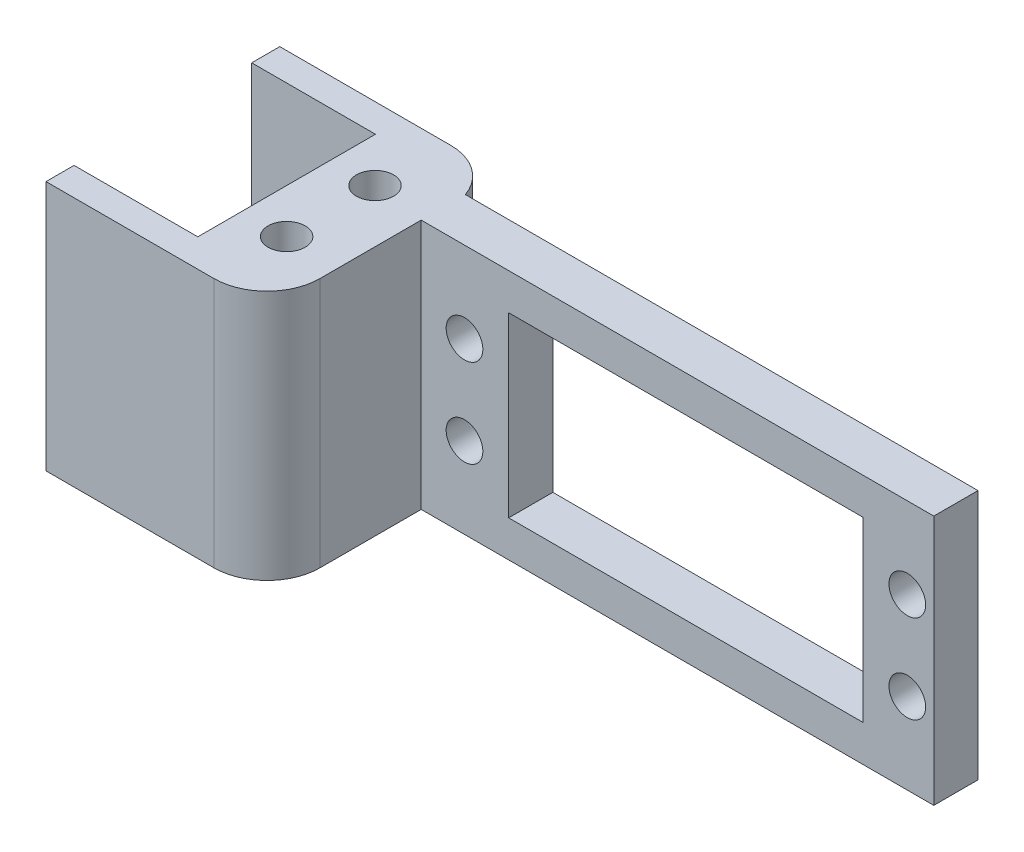
from build123d import *

# Parameters (mm, degrees)
SKETCH1_R               = 2.1
BOSS_EXTRUDE1_DEPTH     = 28.35
SKETCH2_W               = 5
SKETCH2_H               = 28.35
BOSS_EXTRUDE2_DEPTH     = 58
CUT_EXTRUDE1_DEPTH      = 91.535766413
CUT_EXTRUDE1_DEPTH_BACK = 91.535766413
SKETCH3_W               = 40.1
SKETCH3_H               = 20.1
CUT_EXTRUDE2_DEPTH      = 91.535766413
CUT_EXTRUDE2_DEPTH_BACK = 91.535766413
SKETCH4_R               = 2.075
FILLET1_R               = 6


with BuildPart() as part:
    # Sketch1 → Boss-Extrude1 (new body)
    with BuildSketch(Plane(origin=(0, 0, 0), x_dir=(1, 0, 0), z_dir=(0, 1, 0))):
        Polygon((0, 0), (14, 0), (14, -20.1), (0, -20.1), (0, -23.275), (25, -23.275), (25, 3.175), (0, 3.175), align=None)
        with Locations(Location((19, -5.05, 0), (0, 0, 90))):
            Circle(SKETCH1_R, mode=Mode.SUBTRACT)
        with Locations(Location((19, -15.05, 0), (0, 0, 90))):
            Circle(SKETCH1_R, mode=Mode.SUBTRACT)
    extrude(amount=BOSS_EXTRUDE1_DEPTH)

    # Sketch2 → Boss-Extrude2 (add)
    with BuildSketch(Plane(origin=(25, 0, 0), x_dir=(0, 0, -1), z_dir=(1, 0, 0))):
        with Locations((-3.325, 14.175)):
            Rectangle(SKETCH2_W, SKETCH2_H)
    extrude(amount=BOSS_EXTRUDE2_DEPTH)

    # Sketch3 → Cut-Extrude1 (cut, two sides: drawn at the far end of the back side and taken through both)
    with BuildSketch(Plane(origin=(0, 0, 0.825), x_dir=(-1, 0, 0), z_dir=(0, 0, -1)).offset(-CUT_EXTRUDE1_DEPTH_BACK)):
        with Locations((-54.95, 14.175)):
            Rectangle(SKETCH3_W, SKETCH3_H)
    extrude(amount=CUT_EXTRUDE1_DEPTH + CUT_EXTRUDE1_DEPTH_BACK, mode=Mode.SUBTRACT)

    # Sketch4 → Cut-Extrude2 (cut, two sides: drawn at the far end of the back side and taken through both)
    with BuildSketch(Plane(origin=(0, 0, 0.825), x_dir=(-1, 0, 0), z_dir=(0, 0, -1)).offset(-CUT_EXTRUDE2_DEPTH_BACK)):
        with Locations(Location((-29.9, 19.175, 0), (0, 0, 90))):
            Circle(SKETCH4_R)
        with Locations(Location((-29.9, 9.175, 0), (0, 0, 90))):
            Circle(SKETCH4_R)
        with Locations(Location((-80, 19.175, 0), (0, 0, 90))):
            Circle(SKETCH4_R)
        with Locations(Location((-80, 9.175, 0), (0, 0, 90))):
            Circle(SKETCH4_R)
    extrude(amount=CUT_EXTRUDE2_DEPTH + CUT_EXTRUDE2_DEPTH_BACK, mode=Mode.SUBTRACT)

    # Fillet1
    # the kernel refuses this fillet: 6 mm, written as the material it takes off along each edge
    with BuildSketch(Plane(origin=(25, -14.142135624, -3.175), x_dir=(-1, 0, 0), z_dir=(0, 1, 0))) as fillet1_piece_1:
        with BuildLine():
            CenterArc((5.656854249, 6), FILLET1_R, 199.471220634, 70.528779366)
            Line((0, 4), (-0.113137085, 3.96))
            ThreePointArc((-0.113137085, 3.96), (-0.12, 2), (-0.12, 0))
            Line((-0.12, 0), (0, -0.12))
            Line((0, -0.12), (5.656854249, -0.12))
            Line((5.656854249, -0.12), (5.656854249, 0))
        make_face()
    extrude(amount=56.634271247, mode=Mode.SUBTRACT)
    with BuildSketch(Plane(origin=(25, -15, 23.275), x_dir=(-1, 0, 0), z_dir=(0, 1, 0))) as fillet1_piece_2:
        with BuildLine():
            CenterArc((FILLET1_R, -FILLET1_R), FILLET1_R, 90, 90)
            Line((0, -FILLET1_R), (-FILLET1_R * 0.02, -FILLET1_R))
            Line((-FILLET1_R * 0.02, -FILLET1_R), (-FILLET1_R * 0.02, FILLET1_R * 0.02))
            Line((-FILLET1_R * 0.02, FILLET1_R * 0.02), (FILLET1_R, FILLET1_R * 0.02))
            Line((FILLET1_R, FILLET1_R * 0.02), (FILLET1_R, 0))
        make_face()
    extrude(amount=58.35, mode=Mode.SUBTRACT)


solid = part.part
